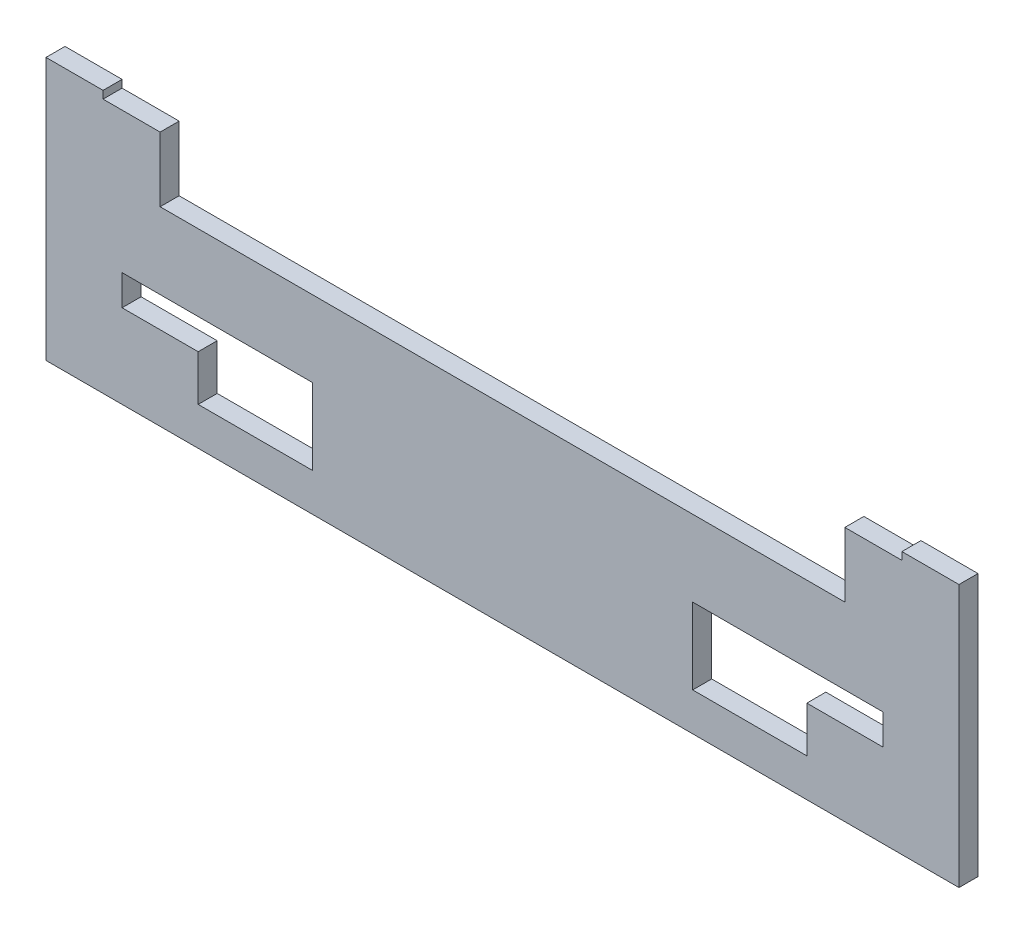
from build123d import *

# Parameters (mm, degrees)
BOSS_EXTRUDE1_DEPTH = 5
CUT_EXTRUDE5_REACH  = 251.772


with BuildPart() as part:
    # Sketch1 → Boss-Extrude1 (new body)
    with BuildSketch(Plane.XY):
        Polygon((0, 0), (240, 0), (240, 69), (225, 69), (225, 67), (210, 67), (210, 50), (30, 50), (30, 67), (15, 67), (15, 69), (0, 69), align=None)
    extrude(amount=BOSS_EXTRUDE1_DEPTH)

    # Sketch6 → Cut-Extrude5 (cut, up to next)
    with BuildSketch(Plane.XY.offset(5), mode=Mode.PRIVATE) as cut_extrude5_sk1:
        Polygon((20, 30), (70, 30), (70, 10), (40, 10), (40, 22), (20, 22), align=None)
    cut_extrude5_tool1 = extrude(cut_extrude5_sk1.sketch, amount=-CUT_EXTRUDE5_REACH, mode=Mode.PRIVATE) & part.part
    # Sketch6 → Cut-Extrude5 (cut, up to next)
    with BuildSketch(Plane.XY.offset(5), mode=Mode.PRIVATE) as cut_extrude5_sk2:
        Polygon((220, 22), (220, 30), (170, 30), (170, 10), (200, 10), (200, 22), align=None)
    cut_extrude5_tool2 = extrude(cut_extrude5_sk2.sketch, amount=-CUT_EXTRUDE5_REACH, mode=Mode.PRIVATE) & part.part
    add(cut_extrude5_tool1.solids().sort_by_distance((49.736842, 21.263158, 5))[0], mode=Mode.SUBTRACT)
    add(cut_extrude5_tool2.solids().sort_by_distance((190.263158, 21.263158, 5))[0], mode=Mode.SUBTRACT)


solid = part.part
